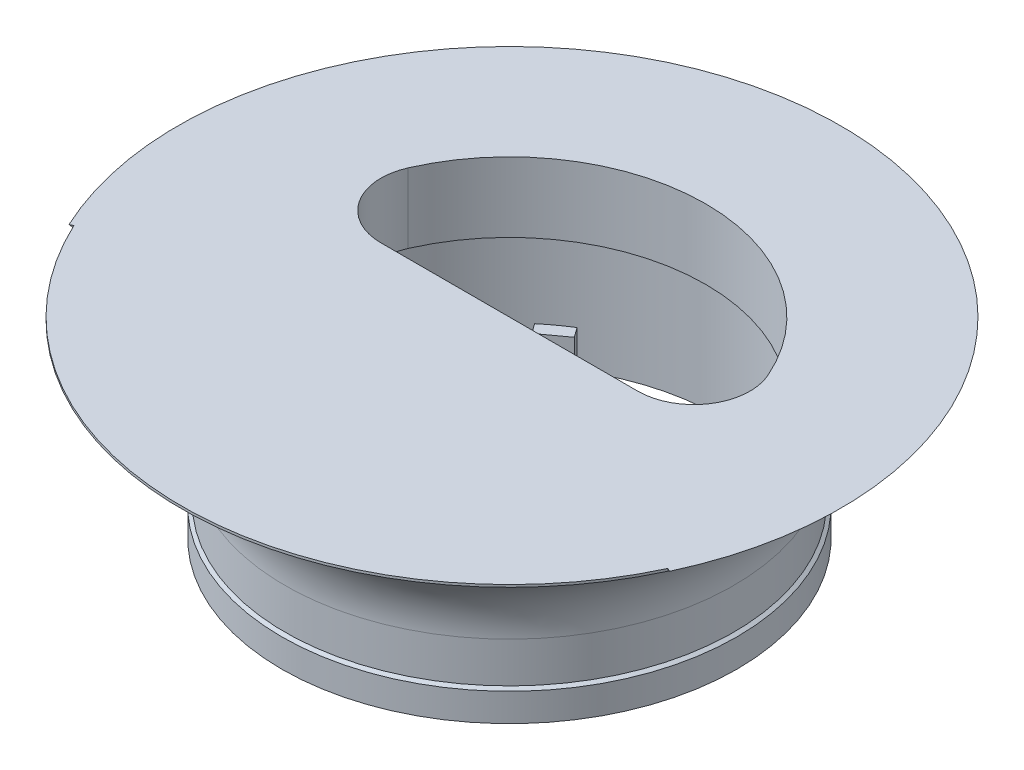
from build123d import *

# Parameters (mm, degrees)
CUT_EXTRUDE3_DEPTH           = 60
CUT_EXTRUDE5_DEPTH           = 2
CUT_EXTRUDE5_DEPTH_BACK      = 30
SKETCH9_R                    = 38
SKETCH9_R_2                  = 23
SKETCH19_W                   = 12
SKETCH19_H                   = 36.5
CUT_REVOLVE2_ANGLE           = 65
CUT_REVOLVE2_OTHER_WAY_ANGLE = 65
SKETCH21_W                   = 3.25
SKETCH21_H                   = 4
BOSS_EXTRUDE3_DEPTH          = 1.35
CIRPATTERN1_COUNT            = 5
CUT_EXTRUDE9_START           = -5
CUT_EXTRUDE9_DEPTH           = 5
SKETCH23_R                   = 10.5
CUT_EXTRUDE10_DEPTH          = 10
SKETCH24_W                   = 17
SKETCH24_H                   = 12
BOSS_EXTRUDE4_DEPTH          = 8
SKETCH26_W                   = 12
SKETCH26_H                   = 8
CUT_EXTRUDE11_DEPTH          = 10
SKETCH27_W                   = 4
SKETCH27_H                   = 5
CUT_EXTRUDE12_DEPTH          = 5
CUT_EXTRUDE14_DEPTH          = 2
CUT_EXTRUDE14_DEPTH_BACK     = 30
SKETCH29_R                   = 1
CUT_EXTRUDE15_DEPTH          = 15
FILLET1_R                    = 6
FILLET2_R                    = 8
SKETCH30_W                   = 97.703590575
SKETCH30_H                   = 5
CUT_EXTRUDE16_DEPTH          = 5
INTERSECT1_START             = 20.469057744
INTERSECT1_DEPTH             = 42.958818353


# Read off the part's stored shape, not the designer's step: Cut-Extrude9, Intersect1
with BuildPart() as part:
    # Sketch1 → Revolve1 (revolve)
    with BuildSketch(Plane.XY, mode=Mode.PRIVATE) as revolve1_sk:
        with BuildLine():
            Line((0, 63.427876097), (32, 63.427876097))
            ThreePointArc((32, 63.427876097), (37.656854249, 61.084730346), (40, 55.427876097))
            Line((40, 55.427876097), (40, 28.846818009))
            ThreePointArc((40, 28.846818009), (38.792081772, 24.082439968), (35.460140376, 20.469057744))
            Line((35.460140376, 20.469057744), (28.539859624, 15.958818353))
            ThreePointArc((28.539859624, 15.958818353), (25.207918228, 12.345436129), (24, 7.581058088))
            Line((24, 7.581058088), (24, 3.25))
            Line((24, 3.25), (24.35, 3))
            Line((24.35, 3), (24.35, 0))
            Line((24.35, 0), (22.5, 0))
            Line((22.5, 0), (22.5, 12.5))
            ThreePointArc((22.5, 12.5), (22.353553391, 12.853553391), (22, 13))
            Line((22, 13), (0, 13))
            Line((0, 13), (0, 63.427876097))
        make_face()
    revolve(revolve1_sk.sketch.rotate(Axis((0, 0, 0), (0, 1, 0)), 90), axis=Axis((0, 0, 0), (0, 1, 0)))

    # Sketch11 → Cut-Extrude3 (cut)
    with BuildSketch(Plane(origin=(0, 13, 0), x_dir=(-1, 0, 0), z_dir=(0, -1, 0))):
        with BuildLine():
            Line((-21, 0), (21, 0))
            ThreePointArc((21, 0), (0, 21), (-21, 0))
        make_face()
    extrude(amount=-CUT_EXTRUDE3_DEPTH, mode=Mode.SUBTRACT)

    # Sketch9 → Cut-Extrude5 (cut, two sides: drawn at the far end of the back side and taken through both)
    with BuildSketch(Plane(origin=(0, 55.427876097, 0), x_dir=(1, 0, 0), z_dir=(0, 1, 0)).offset(-CUT_EXTRUDE5_DEPTH_BACK)):
        with Locations(Location((0, 0, 0), (0, 0, 270))):
            Circle(SKETCH9_R)
        with Locations(Location((0, 0, 0), (0, 0, 270))):
            Circle(SKETCH9_R_2, mode=Mode.SUBTRACT)
    extrude(amount=CUT_EXTRUDE5_DEPTH + CUT_EXTRUDE5_DEPTH_BACK, mode=Mode.SUBTRACT)

    # Sketch19 → Cut-Revolve2 (revolve, cut)
    with BuildSketch(Plane(origin=(0, 0, 0), x_dir=(0, 0, -1), z_dir=(1, 0, 0))):
        with Locations((-41.064715832, 37.177876097)):
            Rectangle(SKETCH19_W, SKETCH19_H)
    revolve(axis=Axis((0, 0, 0), (0, 1, 0)), revolution_arc=CUT_REVOLVE2_ANGLE, mode=Mode.SUBTRACT)

    # Sketch19 → Cut-Revolve2 other way (revolve, cut)
    with BuildSketch(Plane(origin=(0, 0, 0), x_dir=(0, 0, -1), z_dir=(1, 0, 0))):
        with Locations((-41.064715832, 37.177876097)):
            Rectangle(SKETCH19_W, SKETCH19_H)
    revolve(axis=Axis((0, 0, 0), (0, -1, 0)), revolution_arc=CUT_REVOLVE2_OTHER_WAY_ANGLE, mode=Mode.SUBTRACT)

    # Sketch21 → Boss-Extrude3 (add)
    with BuildSketch(Plane(origin=(0, 0, 22.5), x_dir=(-1, 0, 0), z_dir=(0, 0, -1))):
        with Locations((0, 2)):
            Rectangle(SKETCH21_W, SKETCH21_H)
    boss_extrude3 = extrude(amount=BOSS_EXTRUDE3_DEPTH)

    # CirPattern1: Boss-Extrude3 ×5 about axis
    cirpattern1_axis = Axis((0, 0, 0), (0, 1, 0))
    for i in range(1, CIRPATTERN1_COUNT):
        add(boss_extrude3.rotate(cirpattern1_axis, i * 360 / CIRPATTERN1_COUNT))

    # Cut-Extrude9 outline → Cut-Extrude9 (cut)
    with BuildSketch(Plane(origin=(0, 63.427876097, 0), x_dir=(1, 0, 0), z_dir=(0, 1, 0)).offset(CUT_EXTRUDE9_START)):
        with BuildLine():
            ThreePointArc((40, 0), (0, 40), (-40, 0))
            Line((-40, 0), (-21, 0))
            ThreePointArc((-21, 0), (0, 21), (21, 0))
            Line((21, 0), (40, 0))
        make_face()
    extrude(amount=CUT_EXTRUDE9_DEPTH, mode=Mode.SUBTRACT)

    # Sketch23 → Cut-Extrude10 (cut)
    with BuildSketch(Plane(origin=(0, 0, -40), x_dir=(-1, 0, 0), z_dir=(0, 0, -1))):
        with Locations((0, 42.137876097)):
            Circle(SKETCH23_R)
    extrude(amount=-CUT_EXTRUDE10_DEPTH, mode=Mode.SUBTRACT)

    # Sketch24 → Boss-Extrude4 (add)
    with BuildSketch(Plane(origin=(0, 58.427876097, 0), x_dir=(1, 0, 0), z_dir=(0, 1, 0))):
        with Locations((0, 30)):
            Rectangle(SKETCH24_W, SKETCH24_H)
    extrude(amount=-BOSS_EXTRUDE4_DEPTH)

    # Sketch26 → Cut-Extrude11 (cut)
    with BuildSketch(Plane(origin=(0, 58.427876097, 0), x_dir=(1, 0, 0), z_dir=(0, 1, 0))):
        with Locations((0, 30)):
            Rectangle(SKETCH26_W, SKETCH26_H)
    extrude(amount=-CUT_EXTRUDE11_DEPTH, mode=Mode.SUBTRACT)

    # Sketch27 → Cut-Extrude12 (cut)
    with BuildSketch(Plane(origin=(8.5, 0, 0), x_dir=(0, 0, -1), z_dir=(1, 0, 0))):
        with Locations((29.5, 53.927876097)):
            Rectangle(SKETCH27_W, SKETCH27_H)
    extrude(amount=-CUT_EXTRUDE12_DEPTH, mode=Mode.SUBTRACT)

    # Sketch28 → Cut-Extrude14 (cut, two sides: drawn at the far end of the back side and taken through both)
    with BuildSketch(Plane(origin=(0, 55.427876097, 0), x_dir=(1, 0, 0), z_dir=(0, 1, 0)).offset(-CUT_EXTRUDE14_DEPTH_BACK)):
        with BuildLine():
            Line((-22.912878475, -2), (22.912878475, -2))
            ThreePointArc((22.912878475, -2), (0, -23), (-22.912878475, -2))
        make_face()
    extrude(amount=CUT_EXTRUDE14_DEPTH + CUT_EXTRUDE14_DEPTH_BACK, mode=Mode.SUBTRACT)

    # Sketch29 → Cut-Extrude15 (cut)
    with BuildSketch(Plane(origin=(0, 0, 0), x_dir=(-1, 0, 0), z_dir=(0, 0, -1))):
        with Locations((-30.416198487, 60.927876097)):
            Circle(SKETCH29_R)
        with Locations((30.416198487, 60.927876097)):
            Circle(SKETCH29_R)
        with Locations((0, 60.927876097)):
            Circle(SKETCH29_R)
    extrude(amount=-CUT_EXTRUDE15_DEPTH, mode=Mode.SUBTRACT)

    # Fillet1
    fillet1_edges = [part.edges().sort_by_distance(p)[0] for p in [
        (21, 35.713938048, 0),
        (-21, 35.713938048, 0),
    ]]
    fillet(fillet1_edges, radius=FILLET1_R)

    # Fillet2
    fillet2_edges = [part.edges().sort_by_distance(p)[0] for p in [
        (-22.912878475, 41.427876097, 2),
        (22.912878475, 41.427876097, 2),
    ]]
    fillet(fillet2_edges, radius=FILLET2_R)

    # Sketch30 → Cut-Extrude16 (cut)
    with BuildSketch(Plane(origin=(0, 63.427876097, 0), x_dir=(1, 0, 0), z_dir=(0, 1, 0))):
        with Locations((-0.528699084, -2.5)):
            Rectangle(SKETCH30_W, SKETCH30_H)
    extrude(amount=-CUT_EXTRUDE16_DEPTH, mode=Mode.SUBTRACT)

    # Intersect1 outline → Intersect1 (cut)
    with BuildSketch(Plane(origin=(0, 0, 0), x_dir=(1, 0, 0), z_dir=(0, 1, 0)).offset(INTERSECT1_START)):
        with BuildLine():
            Line((-37.080992435, -15), (-42, -15))
            Line((-42, -15), (-42, -42))
            Line((-42, -42), (42, -42))
            Line((42, -42), (42, -15))
            Line((42, -15), (37.080992435, -15))
            ThreePointArc((37.080992435, -15), (0, 40), (-37.080992435, -15))
        make_face()
        with BuildLine():
            Line((13.747727085, 0), (-13.747727085, 0))
            ThreePointArc((-13.747727085, 0), (-18.767687244, 2.713664655), (-19.246817919, 8.4))
            ThreePointArc((-19.246817919, 8.4), (0, 21), (19.246817919, 8.4))
            ThreePointArc((19.246817919, 8.4), (18.767687244, 2.713664655), (13.747727085, 0))
        make_face(mode=Mode.SUBTRACT)
    extrude(amount=INTERSECT1_DEPTH, mode=Mode.SUBTRACT)


solid = part.part
